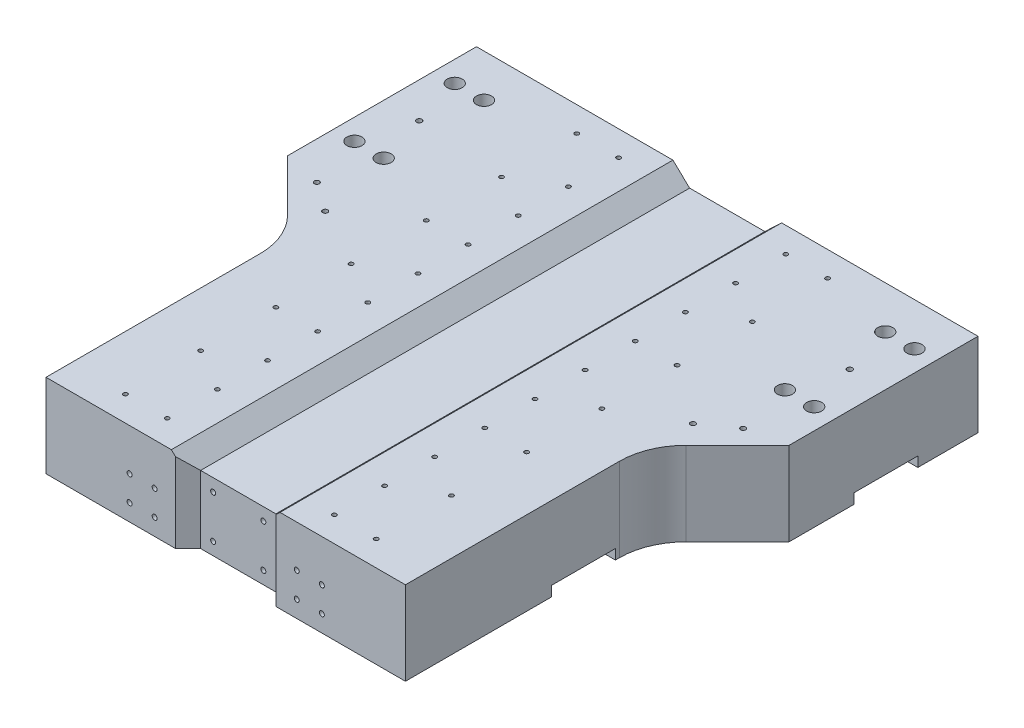
from build123d import *

# Parameters (mm, degrees)
SKETCH1_W                           = 600
SKETCH1_H                           = 600
BOSS_EXTRUDE1_DEPTH                 = 100
CUT_EXTRUDE1_DEPTH                  = 436.889894354
CHAMFER5_SIZE                       = 85
CUT_EXTRUDE2_DEPTH                  = 679.232998313
SKETCH9_R                           = 9.017
CUT_EXTRUDE5_DEPTH                  = 436.889894354
SKETCH12_R                          = 2.5
CUT_EXTRUDE7_DEPTH                  = 30
SKETCH14_W                          = 90
SKETCH14_H                          = 15
CUT_EXTRUDE8_DEPTH                  = 432.927077179
CHAMFER3_SIZE                       = 15
SKETCH15_W                          = 76.2
SKETCH15_H                          = 12.7
CUT_EXTRUDE9_DEPTH                  = 679.232998313
F_6_0MM_DOWEL_HOLE1_D               = 6
F_6_0MM_DOWEL_HOLE1_DEPTH           = 30
F_6_0MM_DOWEL_HOLE1_TIP             = 1.802581857
F_6_0MM_DOWEL_HOLE1_ON_FACE_2_D     = 6
F_6_0MM_DOWEL_HOLE1_ON_FACE_2_DEPTH = 30
F_6_0MM_DOWEL_HOLE1_ON_FACE_2_TIP   = 1.802581857
F_6_0MM_DOWEL_HOLE1_ON_FACE_3_D     = 6
F_6_0MM_DOWEL_HOLE1_ON_FACE_3_DEPTH = 30
F_6_0MM_DOWEL_HOLE1_ON_FACE_3_TIP   = 1.802581857
SKETCH23_R                          = 3.175
CUT_EXTRUDE10_DEPTH                 = 436.889894354
SKETCH24_R                          = 3
CUT_EXTRUDE11_DEPTH                 = 20
FILLET1_R                           = 80
F_5_0MM_DOWEL_HOLE1_D               = 5
F_5_0MM_DOWEL_HOLE1_DEPTH           = 28.497848452
F_5_0MM_DOWEL_HOLE1_TIP             = 1.502151548


with BuildPart() as part:
    # Sketch1 → Boss-Extrude1 (new body)
    with BuildSketch(Plane(origin=(0, 0, 0), x_dir=(1, 0, 0), z_dir=(0, 1, 0))):
        Rectangle(SKETCH1_W, SKETCH1_H)
    extrude(amount=BOSS_EXTRUDE1_DEPTH)

    # Sketch2 → Cut-Extrude1 (cut, through all)
    with BuildSketch(Plane(origin=(0, 100, 0), x_dir=(1, 0, 0), z_dir=(0, 1, 0))):
        Polygon((-300, -300), (-220, -300), (-215, -300), (-215, 74), (-220, 74), (-300, 74), (-300, 60), align=None)
        Polygon((300, -300), (220, -300), (215, -300), (215, 74), (220, 74), (300, 74), (300, 60), align=None)
    extrude(amount=-CUT_EXTRUDE1_DEPTH, mode=Mode.SUBTRACT)

    # Chamfer5
    chamfer5_edges = [part.edges().sort_by_distance(p)[0] for p in [
        (-215, 50, -74),
        (215, 50, -74),
    ]]
    chamfer(chamfer5_edges, length=CHAMFER5_SIZE - 0.0001)  # a hair under: the kernel refuses the full size

    # Sketch3 → Cut-Extrude2 (cut, through all)
    with BuildSketch(Plane.XY.offset(300)):
        Polygon((-35, 81), (-45, 81), (-65, 100), (-45, 100), (45, 100), (65, 100), (45, 81), (35, 81), (0, 81), align=None)
    extrude(amount=-CUT_EXTRUDE2_DEPTH, mode=Mode.SUBTRACT)

    # Sketch9 → Cut-Extrude5 (cut, through all)
    with BuildSketch(Plane(origin=(0, 100, 0), x_dir=(1, 0, 0), z_dir=(0, 1, 0))):
        with Locations(Location((275, 129, 0), (0, 0, 270))):
            Circle(SKETCH9_R)
        with Locations(Location((240, 129, 0), (0, 0, 270))):
            Circle(SKETCH9_R)
        with Locations(Location((240, 249, 0), (0, 0, 270))):
            Circle(SKETCH9_R)
        with Locations(Location((275, 249, 0), (0, 0, 270))):
            Circle(SKETCH9_R)
        with Locations(Location((-275, 129, 0), (0, 0, 90))):
            Circle(SKETCH9_R)
        with Locations(Location((-240, 249, 0), (0, 0, 90))):
            Circle(SKETCH9_R)
        with Locations(Location((-275, 249, 0), (0, 0, 90))):
            Circle(SKETCH9_R)
        with Locations(Location((-240, 129, 0), (0, 0, 90))):
            Circle(SKETCH9_R)
    extrude(amount=-CUT_EXTRUDE5_DEPTH, mode=Mode.SUBTRACT)

    # Sketch12 → Cut-Extrude7 (cut)
    with BuildSketch(Plane(origin=(0, 100, 0), x_dir=(1, 0, 0), z_dir=(0, 1, 0))):
        with Locations(Location((-100, -270, 0), (0, 0, 270))):
            Circle(SKETCH12_R)
        with Locations(Location((100, -270, 0), (0, 0, 270))):
            Circle(SKETCH12_R)
        with Locations(Location((100, -210, 0), (0, 0, 270))):
            Circle(SKETCH12_R)
        with Locations(Location((100, -150, 0), (0, 0, 270))):
            Circle(SKETCH12_R)
        with Locations(Location((100, -90, 0), (0, 0, 270))):
            Circle(SKETCH12_R)
        with Locations(Location((100, -30, 0), (0, 0, 270))):
            Circle(SKETCH12_R)
        with Locations(Location((100, 30, 0), (0, 0, 270))):
            Circle(SKETCH12_R)
        with Locations(Location((100, 90, 0), (0, 0, 270))):
            Circle(SKETCH12_R)
        with Locations(Location((100, 150, 0), (0, 0, 270))):
            Circle(SKETCH12_R)
        with Locations(Location((100, 210, 0), (0, 0, 270))):
            Circle(SKETCH12_R)
        with Locations(Location((100, 270, 0), (0, 0, 270))):
            Circle(SKETCH12_R)
        with Locations(Location((-100, -210, 0), (0, 0, 270))):
            Circle(SKETCH12_R)
        with Locations(Location((-100, -150, 0), (0, 0, 270))):
            Circle(SKETCH12_R)
        with Locations(Location((-100, -90, 0), (0, 0, 270))):
            Circle(SKETCH12_R)
        with Locations(Location((-100, -30, 0), (0, 0, 270))):
            Circle(SKETCH12_R)
        with Locations(Location((-100, 30, 0), (0, 0, 270))):
            Circle(SKETCH12_R)
        with Locations(Location((-100, 90, 0), (0, 0, 270))):
            Circle(SKETCH12_R)
        with Locations(Location((-100, 150, 0), (0, 0, 270))):
            Circle(SKETCH12_R)
        with Locations(Location((-100, 210, 0), (0, 0, 270))):
            Circle(SKETCH12_R)
        with Locations(Location((-100, 270, 0), (0, 0, 270))):
            Circle(SKETCH12_R)
    extrude(amount=-CUT_EXTRUDE7_DEPTH, mode=Mode.SUBTRACT)

    # Sketch14 → Cut-Extrude8 (cut, through all)
    with BuildSketch(Plane(origin=(0, 81, 0), x_dir=(1, 0, 0), z_dir=(0, 1, 0))):
        with Locations((0, -292.5)):
            Rectangle(SKETCH14_W, SKETCH14_H)
    extrude(amount=-CUT_EXTRUDE8_DEPTH, mode=Mode.SUBTRACT)

    # Chamfer3
    chamfer3_edges = [part.edges().sort_by_distance(p)[0] for p in [
        (45, 40.5, 300),
        (-45, 40.5, 300),
    ]]
    chamfer(chamfer3_edges, length=CHAMFER3_SIZE - 0.0001)  # a hair under: the kernel refuses the full size

    # Sketch15 → Cut-Extrude9 (cut, through all)
    with BuildSketch(Plane.ZY.offset(300)):
        with Locations((86.9, 5.65)):
            Rectangle(SKETCH15_W, SKETCH15_H)
        with Locations((-189.9, 5.65)):
            Rectangle(SKETCH15_W, SKETCH15_H)
    extrude(amount=-CUT_EXTRUDE9_DEPTH, mode=Mode.SUBTRACT)

    # Ø6.0mm Dowel Hole1
    with Locations(Plane(origin=(-30, 66, 285), x_dir=(1, 0, 0), z_dir=(0, 0, 1))):
        with Locations((0, 0), (60, 0), (60, -51), (0, -51)):
            Hole(F_6_0MM_DOWEL_HOLE1_D / 2, depth=F_6_0MM_DOWEL_HOLE1_DEPTH)
            with Locations((0, 0, -(F_6_0MM_DOWEL_HOLE1_DEPTH + F_6_0MM_DOWEL_HOLE1_TIP / 2))):  # 118° drill point
                Cone(0, F_6_0MM_DOWEL_HOLE1_D / 2, F_6_0MM_DOWEL_HOLE1_TIP, mode=Mode.SUBTRACT)

    # Ø6.0mm Dowel Hole1 on face 2
    with Locations(Plane(origin=(30, 66, -300), x_dir=(-1, 0, 0), z_dir=(0, 0, -1))):
        with Locations((0, 0), (60, 0), (60, -51), (0, -51), (145, 14), (115, 14), (-55, 14), (-85, 14), (145, -46), (115, -46), (-55, -46), (-85, -46)):
            Hole(F_6_0MM_DOWEL_HOLE1_ON_FACE_2_D / 2, depth=F_6_0MM_DOWEL_HOLE1_ON_FACE_2_DEPTH)
            with Locations((0, 0, -(F_6_0MM_DOWEL_HOLE1_ON_FACE_2_DEPTH + F_6_0MM_DOWEL_HOLE1_ON_FACE_2_TIP / 2))):  # 118° drill point
                Cone(0, F_6_0MM_DOWEL_HOLE1_ON_FACE_2_D / 2, F_6_0MM_DOWEL_HOLE1_ON_FACE_2_TIP, mode=Mode.SUBTRACT)

    # Ø6.0mm Dowel Hole1 on face 3
    with Locations(Plane(origin=(-85, 50, 300), x_dir=(1, 0, 0), z_dir=(0, 0, 1))):
        with Locations((0, 0), (-30, 0), (170, 0), (200, 0), (-30, -30), (0, -30), (170, -30), (200, -30)):
            Hole(F_6_0MM_DOWEL_HOLE1_ON_FACE_3_D / 2, depth=F_6_0MM_DOWEL_HOLE1_ON_FACE_3_DEPTH)
            with Locations((0, 0, -(F_6_0MM_DOWEL_HOLE1_ON_FACE_3_DEPTH + F_6_0MM_DOWEL_HOLE1_ON_FACE_3_TIP / 2))):  # 118° drill point
                Cone(0, F_6_0MM_DOWEL_HOLE1_ON_FACE_3_D / 2, F_6_0MM_DOWEL_HOLE1_ON_FACE_3_TIP, mode=Mode.SUBTRACT)

    # Sketch23 → Cut-Extrude10 (cut, through all)
    with BuildSketch(Plane(origin=(0, 100, 0), x_dir=(1, 0, 0), z_dir=(0, 1, 0))):
        with Locations(Location((-257.5, 189, 0), (0, 0, 270))):
            Circle(SKETCH23_R)
        with Locations(Location((257.5, 189, 0), (0, 0, 270))):
            Circle(SKETCH23_R)
    extrude(amount=-CUT_EXTRUDE10_DEPTH, mode=Mode.SUBTRACT)

    # Sketch24 → Cut-Extrude11 (cut)
    with BuildSketch(Plane(origin=(0, 100, 0), x_dir=(1, 0, 0), z_dir=(0, 1, 0))):
        with Locations(Location((255, 64, 0), (0, 0, 270))):
            Circle(SKETCH24_R)
        with Locations(Location((220, 39, 0), (0, 0, 270))):
            Circle(SKETCH24_R)
        with Locations(Location((-220, 39, 0), (0, 0, 90))):
            Circle(SKETCH24_R)
        with Locations(Location((-255, 64, 0), (0, 0, 90))):
            Circle(SKETCH24_R)
    extrude(amount=-CUT_EXTRUDE11_DEPTH, mode=Mode.SUBTRACT)

    # Fillet1
    fillet1_edges = [part.edges().sort_by_distance(p)[0] for p in [
        (-215, 50, 10.9999),
        (215, 50, 10.9999),
    ]]
    fillet(fillet1_edges, radius=FILLET1_R)

    # Ø5.0mm Dowel Hole1
    with Locations(Plane(origin=(0, 100, 0), x_dir=(1, 0, 0), z_dir=(0, 1, 0))):
        with Locations((-150, 270), (150, 270), (-150, 90), (150, 90), (-150, -90), (150, -90), (-150, -270), (150, -270), (150, 180), (-150, 180), (-150, 0), (150, 0), (150, -180), (-150, -180)):
            Hole(F_5_0MM_DOWEL_HOLE1_D / 2, depth=F_5_0MM_DOWEL_HOLE1_DEPTH)
            with Locations((0, 0, -(F_5_0MM_DOWEL_HOLE1_DEPTH + F_5_0MM_DOWEL_HOLE1_TIP / 2))):  # 118° drill point
                Cone(0, F_5_0MM_DOWEL_HOLE1_D / 2, F_5_0MM_DOWEL_HOLE1_TIP, mode=Mode.SUBTRACT)


solid = part.part
